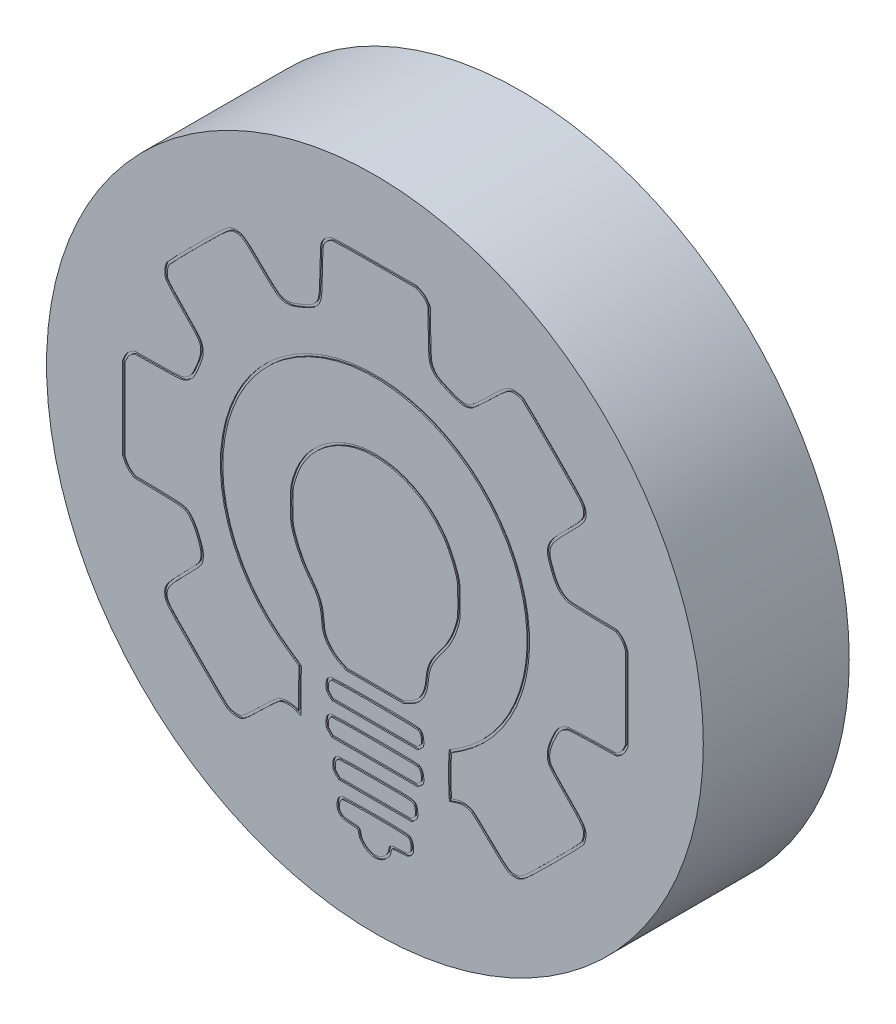
from build123d import *

# Parameters (mm, degrees)
SKETCH1_R           = 27
SKETCH1_R_2         = 25.025
BOSS_EXTRUDE1_DEPTH = 10
SKETCH2_R           = 27
BOSS_EXTRUDE3_DEPTH = 2
CUT_EXTRUDE1_DEPTH  = 0.1


with BuildPart() as part:
    # Sketch1 → Boss-Extrude1 (new body)
    with BuildSketch(Plane.XY):
        Circle(SKETCH1_R)
        Circle(SKETCH1_R_2, mode=Mode.SUBTRACT)
    extrude(amount=BOSS_EXTRUDE1_DEPTH)

    # Sketch2 → Boss-Extrude3 (add)
    with BuildSketch(Plane.XY.offset(10)):
        Circle(SKETCH2_R)
    extrude(amount=BOSS_EXTRUDE3_DEPTH)

    # Sketch4 → Cut-Extrude1 (cut)
    # profile 1 of 6: a face of its own
    with BuildSketch(Plane.XY.offset(12)):
        with BuildLine():
            Line((-17.8576224, 4.620282801), (-19.804957, 4.585005001))
            Line((-19.804957, 4.585005001), (-20.1012904, 4.387449401))
            add(Edge.make_bspline(
                [(-20.1012904, 4.387449401), (-20.3059016, 4.246338201), (-20.4540684, 4.077004601), (-20.574013, 3.823004601)],
                knots=[0, 0, 0, 0, 1, 1, 1, 1], degree=3))
            Line((-20.574013, 3.823004601), (-20.7433464, 3.456115401))
            Line((-20.7433464, 3.456115401), (-20.7433464, 0.062391001))
            Line((-20.7433464, 0.062391001), (-20.7433464, -3.324277799))
            Line((-20.7433464, -3.324277799), (-20.5669574, -3.684111399))
            add(Edge.make_bspline(
                [(-20.5669574, -3.684111399), (-20.4540684, -3.909889199), (-20.2776794, -4.121555999), (-20.0942348, -4.241500599)],
                knots=[0, 0, 0, 0, 1, 1, 1, 1], degree=3))
            Line((-20.0942348, -4.241500599), (-19.804957, -4.446111799))
            Line((-19.804957, -4.446111799), (-17.8576224, -4.481389599))
            add(Edge.make_bspline(
                [(-17.8576224, -4.481389599), (-15.6562876, -4.523722999), (-15.585732, -4.537833999), (-15.1412318, -5.052889999)],
                knots=[0, 0, 0, 0, 1, 1, 1, 1], degree=3))
            add(Edge.make_bspline(
                [(-15.1412318, -5.052889999), (-14.8590094, -5.384501199), (-14.4215646, -6.344057399), (-14.3298424, -6.859113399)],
                knots=[0, 0, 0, 0, 1, 1, 1, 1], degree=3))
            add(Edge.make_bspline(
                [(-14.3298424, -6.859113399), (-14.2945646, -7.035502399), (-14.3016202, -7.303613599), (-14.336898, -7.501169199)],
                knots=[0, 0, 0, 0, 1, 1, 1, 1], degree=3))
            add(Edge.make_bspline(
                [(-14.336898, -7.501169199), (-14.4074536, -7.804558399), (-14.513287, -7.938613999), (-15.7056766, -9.138059199)],
                knots=[0, 0, 0, 0, 1, 1, 1, 1], degree=3))
            add(Edge.make_bspline(
                [(-15.7056766, -9.138059199), (-17.0391774, -10.485671199), (-17.2790664, -10.824337999), (-17.286122, -11.318227199)],
                knots=[0, 0, 0, 0, 1, 1, 1, 1], degree=3))
            add(Edge.make_bspline(
                [(-17.286122, -11.318227199), (-17.286122, -11.960283199), (-17.2578998, -11.995560999), (-14.753176, -14.521451399)],
                knots=[0, 0, 0, 0, 1, 1, 1, 1], degree=3))
            add(Edge.make_bspline(
                [(-14.753176, -14.521451399), (-13.4478974, -15.833785599), (-12.28373, -16.969730799), (-12.1567298, -17.047341999)],
                knots=[0, 0, 0, 0, 1, 1, 1, 1], degree=3))
            add(Edge.make_bspline(
                [(-12.1567298, -17.047341999), (-11.8603964, -17.230786599), (-11.3100626, -17.294286599), (-10.9643402, -17.181397599)],
                knots=[0, 0, 0, 0, 1, 1, 1, 1], degree=3))
            add(Edge.make_bspline(
                [(-10.9643402, -17.181397599), (-10.759729, -17.117897599), (-10.357562, -16.765119599), (-9.3838948, -15.805563399)],
                knots=[0, 0, 0, 0, 1, 1, 1, 1], degree=3))
            add(Edge.make_bspline(
                [(-9.3838948, -15.805563399), (-8.6642276, -15.100007399), (-7.9657272, -14.457951399), (-7.8316716, -14.387395799)],
                knots=[0, 0, 0, 0, 1, 1, 1, 1], degree=3))
            add(Edge.make_bspline(
                [(-7.8316716, -14.387395799), (-7.4859492, -14.203951199), (-6.829782, -14.218062399), (-6.399393, -14.408562599)],
                knots=[0, 0, 0, 0, 1, 1, 1, 1], degree=3))
            Line((-6.399393, -14.408562599), (-6.0677816, -14.563784799))
            Line((-6.0677816, -14.563784799), (-6.0677816, -12.799894799))
            add(Edge.make_bspline(
                [(-6.0677816, -12.799894799), (-6.0677816, -11.833283199), (-6.060726, -11.021893799), (-6.0536704, -10.986615999)],
                knots=[0, 0, 0, 0, 1, 1, 1, 1], degree=3))
            add(Edge.make_bspline(
                [(-6.0536704, -10.986615999), (-6.0536704, -10.958393599), (-6.413504, -10.690282399), (-6.8650598, -10.386893399)],
                knots=[0, 0, 0, 0, 1, 1, 1, 1], degree=3))
            add(Edge.make_bspline(
                [(-6.8650598, -10.386893399), (-9.3133392, -8.750003399), (-10.9784514, -6.576890999), (-11.881563, -3.839333599)],
                knots=[0, 0, 0, 0, 1, 1, 1, 1], degree=3))
            add(Edge.make_bspline(
                [(-11.881563, -3.839333599), (-13.5607864, 1.219502801), (-11.7968964, 6.863950801), (-7.5423936, 10.067175201)],
                knots=[0, 0, 0, 0, 1, 1, 1, 1], degree=3))
            add(Edge.make_bspline(
                [(-7.5423936, 10.067175201), (-3.3796132, 13.192788201), (2.2366126, 13.432677201), (6.6675042, 10.666897801)],
                knots=[0, 0, 0, 0, 1, 1, 1, 1], degree=3))
            add(Edge.make_bspline(
                [(6.6675042, 10.666897801), (11.5005628, 7.654173601), (13.6807308, 1.621669801), (11.8886186, -3.811111399)],
                knots=[0, 0, 0, 0, 1, 1, 1, 1], degree=3))
            add(Edge.make_bspline(
                [(11.8886186, -3.811111399), (11.0066736, -6.506335399), (9.299228, -8.757058999), (6.942671, -10.337504399)],
                knots=[0, 0, 0, 0, 1, 1, 1, 1], degree=3))
            add(Edge.make_bspline(
                [(6.942671, -10.337504399), (6.5475596, -10.598560199), (6.1947816, -10.824337999), (6.1453928, -10.838449199)],
                knots=[0, 0, 0, 0, 1, 1, 1, 1], degree=3))
            add(Edge.make_bspline(
                [(6.1453928, -10.838449199), (6.0183926, -10.880782599), (6.0254482, -14.542618199), (6.1524484, -14.521451399)],
                knots=[0, 0, 0, 0, 1, 1, 1, 1], degree=3))
            add(Edge.make_bspline(
                [(6.1524484, -14.521451399), (6.2018372, -14.514395999), (6.4346708, -14.436784799), (6.6675042, -14.359173599)],
                knots=[0, 0, 0, 0, 1, 1, 1, 1], degree=3))
            add(Edge.make_bspline(
                [(6.6675042, -14.359173599), (7.1261156, -14.189840199), (7.5423936, -14.211006799), (7.937505, -14.408562599)],
                knots=[0, 0, 0, 0, 1, 1, 1, 1], degree=3))
            add(Edge.make_bspline(
                [(7.937505, -14.408562599), (8.050394, -14.472062599), (8.7206722, -15.085896199), (9.4191726, -15.777341199)],
                knots=[0, 0, 0, 0, 1, 1, 1, 1], degree=3))
            add(Edge.make_bspline(
                [(9.4191726, -15.777341199), (10.7032846, -17.047341999), (10.985507, -17.251953199), (11.4370628, -17.251953199)],
                knots=[0, 0, 0, 0, 1, 1, 1, 1], degree=3))
            add(Edge.make_bspline(
                [(11.4370628, -17.251953199), (12.0650076, -17.251953199), (12.1143966, -17.216675399), (14.6261758, -14.719007199)],
                knots=[0, 0, 0, 0, 1, 1, 1, 1], degree=3))
            add(Edge.make_bspline(
                [(14.6261758, -14.719007199), (15.93851, -13.413728599), (17.0744552, -12.249561199), (17.1520664, -12.122560999)],
                knots=[0, 0, 0, 0, 1, 1, 1, 1], degree=3))
            add(Edge.make_bspline(
                [(17.1520664, -12.122560999), (17.2296776, -12.002616599), (17.3072886, -11.741560799), (17.335511, -11.544005199)],
                knots=[0, 0, 0, 0, 1, 1, 1, 1], degree=3))
            add(Edge.make_bspline(
                [(17.335511, -11.544005199), (17.413122, -10.887837999), (17.2720108, -10.676171199), (15.8538434, -9.250948199)],
                knots=[0, 0, 0, 0, 1, 1, 1, 1], degree=3))
            add(Edge.make_bspline(
                [(15.8538434, -9.250948199), (15.105954, -8.503058799), (14.5415092, -7.875113999), (14.4780092, -7.734002799)],
                knots=[0, 0, 0, 0, 1, 1, 1, 1], degree=3))
            add(Edge.make_bspline(
                [(14.4780092, -7.734002799), (14.2945646, -7.296557999), (14.3439534, -6.845002199), (14.640287, -6.104168399)],
                knots=[0, 0, 0, 0, 1, 1, 1, 1], degree=3))
            add(Edge.make_bspline(
                [(14.640287, -6.104168399), (15.0353984, -5.130501199), (15.2470652, -4.855334199), (15.8044544, -4.608389599)],
                knots=[0, 0, 0, 0, 1, 1, 1, 1], degree=3))
            add(Edge.make_bspline(
                [(15.8044544, -4.608389599), (15.9102878, -4.559000799), (16.7287328, -4.509611799), (17.928178, -4.488445199)],
                knots=[0, 0, 0, 0, 1, 1, 1, 1], degree=3))
            Line((17.928178, -4.488445199), (19.8755126, -4.446111799))
            Line((19.8755126, -4.446111799), (20.157735, -4.255611599))
            add(Edge.make_bspline(
                [(20.157735, -4.255611599), (20.3411794, -4.135667199), (20.510513, -3.938111399), (20.6304574, -3.698222399)],
                knots=[0, 0, 0, 0, 1, 1, 1, 1], degree=3))
            Line((20.6304574, -3.698222399), (20.813902, -3.324277799))
            Line((20.813902, -3.324277799), (20.813902, 0.062391001))
            Line((20.813902, 0.062391001), (20.813902, 3.456115401))
            Line((20.813902, 3.456115401), (20.6445686, 3.823004601))
            add(Edge.make_bspline(
                [(20.6445686, 3.823004601), (20.524624, 4.077004601), (20.3764572, 4.246338201), (20.171846, 4.387449401)],
                knots=[0, 0, 0, 0, 1, 1, 1, 1], degree=3))
            Line((20.171846, 4.387449401), (19.8755126, 4.585005001))
            Line((19.8755126, 4.585005001), (17.928178, 4.620282801))
            add(Edge.make_bspline(
                [(17.928178, 4.620282801), (16.0937324, 4.655560601), (15.9667322, 4.669671801), (15.6845098, 4.810783001)],
                knots=[0, 0, 0, 0, 1, 1, 1, 1], degree=3))
            add(Edge.make_bspline(
                [(15.6845098, 4.810783001), (15.2611762, 5.036560801), (15.0142316, 5.382283201), (14.6826204, 6.207783801)],
                knots=[0, 0, 0, 0, 1, 1, 1, 1], degree=3))
            add(Edge.make_bspline(
                [(14.6826204, 6.207783801), (14.1393422, 7.576562401), (14.2310646, 7.830562601), (15.9102878, 9.488619201)],
                knots=[0, 0, 0, 0, 1, 1, 1, 1], degree=3))
            add(Edge.make_bspline(
                [(15.9102878, 9.488619201), (17.1167886, 10.681008801), (17.349622, 10.998509001), (17.3566776, 11.457120401)],
                knots=[0, 0, 0, 0, 1, 1, 1, 1], degree=3))
            add(Edge.make_bspline(
                [(17.3566776, 11.457120401), (17.3566776, 12.099176401), (17.3284554, 12.134454201), (14.8237316, 14.660344601)],
                knots=[0, 0, 0, 0, 1, 1, 1, 1], degree=3))
            add(Edge.make_bspline(
                [(14.8237316, 14.660344601), (13.518453, 15.972678801), (12.3542856, 17.108624001), (12.2272854, 17.186235201)],
                knots=[0, 0, 0, 0, 1, 1, 1, 1], degree=3))
            add(Edge.make_bspline(
                [(12.2272854, 17.186235201), (12.107341, 17.263846401), (11.8462852, 17.341457401), (11.6487296, 17.369679801)],
                knots=[0, 0, 0, 0, 1, 1, 1, 1], degree=3))
            add(Edge.make_bspline(
                [(11.6487296, 17.369679801), (10.9925624, 17.447290801), (10.7667846, 17.306179601), (9.348617, 15.902123201)],
                knots=[0, 0, 0, 0, 1, 1, 1, 1], degree=3))
            add(Edge.make_bspline(
                [(9.348617, 15.902123201), (8.5725054, 15.140122801), (7.9727828, 14.603900201), (7.810505, 14.533344601)],
                knots=[0, 0, 0, 0, 1, 1, 1, 1], degree=3))
            add(Edge.make_bspline(
                [(7.810505, 14.533344601), (7.3801158, 14.356955601), (7.0202822, 14.399289001), (6.1806706, 14.745011401)],
                knots=[0, 0, 0, 0, 1, 1, 1, 1], degree=3))
            add(Edge.make_bspline(
                [(6.1806706, 14.745011401), (5.2563922, 15.126011601), (5.002392, 15.302400601), (4.7907252, 15.746901001)],
                knots=[0, 0, 0, 0, 1, 1, 1, 1], degree=3))
            add(Edge.make_bspline(
                [(4.7907252, 15.746901001), (4.6284474, 16.071456601), (4.6213918, 16.170234601), (4.586114, 17.997624601)],
                knots=[0, 0, 0, 0, 1, 1, 1, 1], degree=3))
            Line((4.586114, 17.997624601), (4.5508362, 19.909681401))
            Line((4.5508362, 19.909681401), (4.360336, 20.191903801))
            add(Edge.make_bspline(
                [(4.360336, 20.191903801), (4.2403916, 20.375348201), (4.0428358, 20.544681801), (3.8029468, 20.664626201)],
                knots=[0, 0, 0, 0, 1, 1, 1, 1], degree=3))
            Line((3.8029468, 20.664626201), (3.4290022, 20.848070801))
            Line((3.4290022, 20.848070801), (0.0423334, 20.841015201))
            add(Edge.make_bspline(
                [(0.0423334, 20.841015201), (-2.166057, 20.841015201), (-3.4290022, 20.812793001), (-3.5630578, 20.763404001)],
                knots=[0, 0, 0, 0, 1, 1, 1, 1], degree=3))
            add(Edge.make_bspline(
                [(-3.5630578, 20.763404001), (-3.8876136, 20.643459601), (-4.1345582, 20.445903801), (-4.3180028, 20.156626001)],
                knots=[0, 0, 0, 0, 1, 1, 1, 1], degree=3))
            add(Edge.make_bspline(
                [(-4.3180028, 20.156626001), (-4.473225, 19.902625801), (-4.4802806, 19.825014601), (-4.5155584, 17.990569001)],
                knots=[0, 0, 0, 0, 1, 1, 1, 1], degree=3))
            add(Edge.make_bspline(
                [(-4.5155584, 17.990569001), (-4.5578918, 15.888012201), (-4.5790584, 15.782178801), (-5.0235588, 15.337678401)],
                knots=[0, 0, 0, 0, 1, 1, 1, 1], degree=3))
            add(Edge.make_bspline(
                [(-5.0235588, 15.337678401), (-5.3128366, 15.041345001), (-6.575782, 14.498066801), (-7.0767266, 14.441622401)],
                knots=[0, 0, 0, 0, 1, 1, 1, 1], degree=3))
            add(Edge.make_bspline(
                [(-7.0767266, 14.441622401), (-7.697616, 14.378122201), (-7.9163384, 14.526289001), (-9.285117, 15.888012201)],
                knots=[0, 0, 0, 0, 1, 1, 1, 1], degree=3))
            add(Edge.make_bspline(
                [(-9.285117, 15.888012201), (-10.5621734, 17.158013001), (-10.8796736, 17.383790801), (-11.3594516, 17.390846401)],
                knots=[0, 0, 0, 0, 1, 1, 1, 1], degree=3))
            add(Edge.make_bspline(
                [(-11.3594516, 17.390846401), (-12.0085632, 17.390846401), (-12.0297298, 17.376735201), (-14.5556202, 14.864956001)],
                knots=[0, 0, 0, 0, 1, 1, 1, 1], degree=3))
            add(Edge.make_bspline(
                [(-14.5556202, 14.864956001), (-15.8679544, 13.552621801), (-17.0038996, 12.388454401), (-17.0815108, 12.261454201)],
                knots=[0, 0, 0, 0, 1, 1, 1, 1], degree=3))
            add(Edge.make_bspline(
                [(-17.0815108, 12.261454201), (-17.2649554, 11.965120801), (-17.3284554, 11.414787001), (-17.2155664, 11.069064601)],
                knots=[0, 0, 0, 0, 1, 1, 1, 1], degree=3))
            add(Edge.make_bspline(
                [(-17.2155664, 11.069064601), (-17.1450108, 10.864453401), (-16.7851772, 10.448175401), (-15.7973988, 9.446285801)],
                knots=[0, 0, 0, 0, 1, 1, 1, 1], degree=3))
            add(Edge.make_bspline(
                [(-15.7973988, 9.446285801), (-14.3933424, 8.021062801), (-14.3227868, 7.915229401), (-14.3227868, 7.252006601)],
                knots=[0, 0, 0, 0, 1, 1, 1, 1], degree=3))
            add(Edge.make_bspline(
                [(-14.3227868, 7.252006601), (-14.3227868, 6.871006401), (-14.8378426, 5.565727801), (-15.1130096, 5.220005401)],
                knots=[0, 0, 0, 0, 1, 1, 1, 1], degree=3))
            add(Edge.make_bspline(
                [(-15.1130096, 5.220005401), (-15.232954, 5.085949801), (-15.458732, 4.895449601), (-15.6139542, 4.810783001)],
                knots=[0, 0, 0, 0, 1, 1, 1, 1], degree=3))
            add(Edge.make_bspline(
                [(-15.6139542, 4.810783001), (-15.8961766, 4.669671801), (-16.0231768, 4.655560601), (-17.8576224, 4.620282801)],
                knots=[0, 0, 0, 0, 1, 1, 1, 1], degree=3))
        make_face()
        with BuildLine():
            Line((-17.853999804, 4.420315488), (-19.742760988, 4.386098924))
            Line((-19.742760988, 4.386098924), (-19.988998471, 4.221940602))
            add(Edge.make_bspline(
                [(-19.988998471, 4.221940602), (-20.031944805, 4.192256832), (-20.116259085, 4.126719412), (-20.219217971, 4.020611115), (-20.309944432, 3.897840015), (-20.368230777, 3.790401494), (-20.393163313, 3.73760325)],
                knots=[0.002322855, 0.002322855, 0.002322855, 0.002322855, 0.251742141, 0.501161428, 0.750580714, 1, 1, 1, 1], degree=3))
            Line((-20.393163313, 3.73760325), (-20.5433464, 3.412188051))
            Line((-20.5433464, 3.412188051), (-20.5433464, 0.062391001))
            Line((-20.5433464, 0.062391001), (-20.5433464, -3.277894705))
            Line((-20.5433464, -3.277894705), (-20.388071993, -3.594668616))
            add(Edge.make_bspline(
                [(-20.388071993, -3.594668616), (-20.36300028, -3.644811999), (-20.306692463, -3.741726783), (-20.204944513, -3.87808915), (-20.091758875, -3.995251995), (-20.02105145, -4.050393939), (-19.981725799, -4.076106876)],
                knots=[0, 0, 0, 0, 0.251389654, 0.502779308, 0.754168962, 1.005558616, 1.005558616, 1.005558616, 1.005558616], degree=3))
            Line((-19.981725799, -4.076106876), (-19.73975041, -4.247260262))
            Line((-19.73975041, -4.247260262), (-17.853999882, -4.281422284))
            add(Edge.make_bspline(
                [(-17.853999882, -4.281422284), (-17.724361492, -4.283915332), (-17.453819989, -4.28921633), (-17.002896567, -4.299435132), (-16.534034814, -4.314630288), (-16.110990122, -4.343193124), (-15.680895353, -4.404039237), (-15.304018058, -4.560937294), (-15.092512889, -4.803227299), (-14.989370443, -4.922741611)],
                knots=[-3.3757e-05, -3.3757e-05, -3.3757e-05, -3.3757e-05, 0.062489449, 0.125012655, 0.250059066, 0.375105477, 0.500151889, 0.750244711, 1.000337534, 1.000337534, 1.000337534, 1.000337534], degree=3))
            add(Edge.make_bspline(
                [(-14.989370443, -4.922741611), (-14.943565969, -4.976561849), (-14.865228651, -5.084425358), (-14.691415251, -5.369134945), (-14.477300316, -5.794339099), (-14.25237379, -6.357143527), (-14.162826339, -6.657345704), (-14.133303292, -6.822016799)],
                knots=[-0.000527359, -0.000527359, -0.000527359, -0.000527359, 0.124392901, 0.249313161, 0.499153681, 0.748994201, 0.998834721, 0.998834721, 0.998834721, 0.998834721], degree=3))
            add(Edge.make_bspline(
                [(-14.133303292, -6.822016799), (-14.122010333, -6.87911225), (-14.108769219, -6.992419568), (-14.104515176, -7.179293924), (-14.115219055, -7.368648653), (-14.130535539, -7.483256449), (-14.140923069, -7.541426597)],
                knots=[0.003225677, 0.003225677, 0.003225677, 0.003225677, 0.254570237, 0.505914798, 0.757259358, 1.008603918, 1.008603918, 1.008603918, 1.008603918], degree=3))
            add(Edge.make_bspline(
                [(-14.140923069, -7.541426597), (-14.161930305, -7.631757747), (-14.212209282, -7.797171483), (-14.379265265, -8.037861162), (-14.605823018, -8.295371401), (-14.838349455, -8.542364551), (-15.097406128, -8.807985278), (-15.345366016, -9.05907912), (-15.492798022, -9.207601592), (-15.563675457, -9.278898571)],
                knots=[-0.005543247, -0.005543247, -0.005543247, -0.005543247, 0.245831167, 0.497205581, 0.622892788, 0.748579995, 0.874267202, 0.937110805, 0.999954408, 0.999954408, 0.999954408, 0.999954408], degree=3))
            add(Edge.make_bspline(
                [(-15.563675457, -9.278898571), (-15.642675197, -9.358734757), (-15.806006643, -9.524544971), (-16.085236301, -9.811778374), (-16.380711098, -10.124429668), (-16.648528199, -10.427212796), (-16.906197943, -10.755083667), (-17.059930803, -11.036057514), (-17.084600877, -11.220338725), (-17.086121949, -11.319701537)],
                knots=[4.0741e-05, 4.0741e-05, 4.0741e-05, 4.0741e-05, 0.062471231, 0.124901721, 0.249762701, 0.374623681, 0.499484661, 0.74920662, 0.99892858, 0.99892858, 0.99892858, 0.99892858], degree=3))
            add(Edge.make_bspline(
                [(-17.086121949, -11.319701537), (-17.086117231, -11.386745649), (-17.084413907, -11.535532863), (-17.059236366, -11.670071993), (-16.987890391, -11.835250623), (-16.822265487, -12.073416255), (-16.531181, -12.412380745), (-16.091097528, -12.879671258), (-15.572807314, -13.40925747), (-15.065405262, -13.922489815), (-14.75822922, -14.232315132), (-14.611267357, -14.380518933)],
                knots=[0.000773296, 0.000773296, 0.000773296, 0.000773296, 0.125674862, 0.250576429, 0.375477995, 0.500379561, 0.625281128, 0.750182694, 0.87508426, 0.937535043, 0.999985827, 0.999985827, 0.999985827, 0.999985827], degree=3))
            add(Edge.make_bspline(
                [(-14.611267357, -14.380518933), (-14.306717222, -14.686714855), (-13.666692614, -15.326098179), (-13.006589843, -15.975708319), (-12.575900628, -16.393082636), (-12.314904262, -16.641501084), (-12.160719843, -16.784223679), (-12.073986415, -16.859392789), (-12.061051316, -16.870198486), (-12.050135025, -16.878106022)],
                knots=[2.7251e-05, 2.7251e-05, 2.7251e-05, 2.7251e-05, 0.244110931, 0.488194611, 0.610236451, 0.732278291, 0.854320131, 0.915341051, 0.976361971, 0.976361971, 0.976361971, 0.976361971], degree=3))
            add(Edge.make_bspline(
                [(-12.050135025, -16.878106022), (-11.983367151, -16.919189423), (-11.849376241, -16.974046867), (-11.555974492, -17.036665757), (-11.254124432, -17.041223723), (-11.102796832, -17.016215711), (-11.025023577, -16.990820351)],
                knots=[0.002002929, 0.002002929, 0.002002929, 0.002002929, 0.251838933, 0.501674936, 0.75151094, 1.001346943, 1.001346943, 1.001346943, 1.001346943], degree=3))
            add(Edge.make_bspline(
                [(-11.025023577, -16.990820351), (-11.007260856, -16.985307785), (-10.98408744, -16.975239279), (-10.857298262, -16.898555205), (-10.622517653, -16.710432005), (-10.252930555, -16.370925917), (-9.875387641, -16.007760256), (-9.636674156, -15.773878692), (-9.524094851, -15.662930957)],
                knots=[-0.002286545, -0.002286545, -0.002286545, -0.002286545, 0.123007203, 0.248300951, 0.498888447, 0.749475942, 0.87476969, 1.000063438, 1.000063438, 1.000063438, 1.000063438], degree=3))
            add(Edge.make_bspline(
                [(-9.524094851, -15.662930957), (-9.34891405, -15.491185093), (-8.982549844, -15.137313644), (-8.506149411, -14.692285877), (-8.196374542, -14.415856912), (-8.023290845, -14.275051966), (-7.962393965, -14.230241667), (-7.92516459, -14.2105933)],
                knots=[-8.6047e-05, -8.6047e-05, -8.6047e-05, -8.6047e-05, 0.249846695, 0.499779438, 0.749712181, 0.874678553, 0.999644924, 0.999644924, 0.999644924, 0.999644924], degree=3))
            add(Edge.make_bspline(
                [(-7.92516459, -14.2105933), (-7.811299785, -14.150220221), (-7.56742397, -14.076567725), (-7.144579367, -14.044726801), (-6.709059692, -14.091343912), (-6.443745675, -14.170215239), (-6.316515073, -14.226530468)],
                knots=[0.000188654, 0.000188654, 0.000188654, 0.000188654, 0.250514884, 0.500841113, 0.751167343, 1.001493572, 1.001493572, 1.001493572, 1.001493572], degree=3))
            Line((-6.316515073, -14.226530468), (-6.2677816, -14.249341858))
            Line((-6.2677816, -14.249341858), (-6.2677816, -12.799894799))
            add(Edge.make_bspline(
                [(-6.2677816, -12.799894799), (-6.2677816, -12.608473499), (-6.267182992, -12.209786333), (-6.264825426, -11.706826682), (-6.262045632, -11.372930591), (-6.259310913, -11.168973206), (-6.258138498, -11.104254677), (-6.257253653, -11.067243772)],
                knots=[0, 0, 0, 0, 0.206566596, 0.413133192, 0.619699788, 0.722983086, 0.826266384, 0.826266384, 0.826266384, 0.826266384], degree=3))
            add(Edge.make_bspline(
                [(-6.257253653, -11.067243772), (-6.295588272, -11.036072054), (-6.362075568, -10.984982701), (-6.535968972, -10.857292412), (-6.738361702, -10.714718854), (-6.898814391, -10.605165246), (-6.976410537, -10.553029081)],
                knots=[0.277509677, 0.277509677, 0.277509677, 0.277509677, 0.458097373, 0.638685068, 0.819272763, 0.999860458, 0.999860458, 0.999860458, 0.999860458], degree=3))
            add(Edge.make_bspline(
                [(-6.976410537, -10.553029081), (-7.580755516, -10.148958006), (-8.746945247, -9.235362339), (-10.159181577, -7.682029322), (-11.285444171, -5.921439665), (-11.847313247, -4.581511199), (-12.071436928, -3.902166112)],
                knots=[2.5476e-05, 2.5476e-05, 2.5476e-05, 2.5476e-05, 0.250013865, 0.500002254, 0.749990643, 0.999979032, 0.999979032, 0.999979032, 0.999979032], degree=3))
            add(Edge.make_bspline(
                [(-12.071436928, -3.902166112), (-12.282228025, -3.267104681), (-12.603137776, -1.952310757), (-12.813485192, 0.676099754), (-12.317130169, 3.928676141), (-10.875097095, 6.885456928), (-9.207685602, 8.926693482), (-8.196759389, 9.824850469), (-7.662585295, 10.227031304)],
                knots=[1.133e-05, 1.133e-05, 1.133e-05, 1.133e-05, 0.125010941, 0.250010551, 0.500009773, 0.750008995, 0.875008605, 1.000008216, 1.000008216, 1.000008216, 1.000008216], degree=3))
            add(Edge.make_bspline(
                [(-7.662585295, 10.227031304), (-7.140907212, 10.618731956), (-6.027732184, 11.328372908), (-3.682853066, 12.360842936), (-0.555089935, 12.964067685), (2.615418046, 12.627582193), (5.044778987, 11.796710786), (6.218325729, 11.183038292), (6.773355171, 10.836590393)],
                knots=[-8.405e-06, -8.405e-06, -8.405e-06, -8.405e-06, 0.124992167, 0.249992739, 0.499993884, 0.749995028, 0.874995601, 0.999996173, 0.999996173, 0.999996173, 0.999996173], degree=3))
            add(Edge.make_bspline(
                [(6.773355171, 10.836590393), (7.379074432, 10.459006529), (8.534841449, 9.590135935), (10.458198228, 7.544909813), (12.161926063, 4.480563269), (12.809013675, 1.030300858), (12.636804497, -1.779923836), (12.303087842, -3.193040738), (12.078626469, -3.873537882)],
                knots=[3.509e-06, 3.509e-06, 3.509e-06, 3.509e-06, 0.125001358, 0.249999208, 0.499994908, 0.749990608, 0.874988458, 0.999986308, 0.999986308, 0.999986308, 0.999986308], degree=3))
            add(Edge.make_bspline(
                [(12.078626469, -3.873537882), (11.857632096, -4.548855618), (11.300914548, -5.874102573), (10.173959006, -7.64849283), (8.769640765, -9.213114928), (7.643893104, -10.108037585), (7.053497388, -10.503991595)],
                knots=[2.7633e-05, 2.7633e-05, 2.7633e-05, 2.7633e-05, 0.250040962, 0.500054291, 0.75006762, 1.00008095, 1.00008095, 1.00008095, 1.00008095], degree=3))
            add(Edge.make_bspline(
                [(7.053497388, -10.503991595), (6.976767671, -10.554688025), (6.817738761, -10.659153263), (6.610119452, -10.793632721), (6.4284188, -10.908248641), (6.35357326, -10.953864522), (6.309526847, -10.979095707)],
                knots=[-0.000485027, -0.000485027, -0.000485027, -0.000485027, 0.199236321, 0.39895767, 0.598679018, 0.798400367, 0.798400367, 0.798400367, 0.798400367], degree=3))
            add(Edge.make_bspline(
                [(6.309526847, -10.979095707), (6.304484903, -11.013501136), (6.297864558, -11.073245619), (6.282332961, -11.268592478), (6.268020454, -11.580067285), (6.256916456, -12.039553824), (6.252594353, -12.543490524), (6.254802417, -13.056938713), (6.263607468, -13.544737706), (6.276046367, -13.896683964), (6.289574452, -14.133822393), (6.296315324, -14.221911391), (6.300776244, -14.269672652)],
                knots=[0.098871727, 0.098871727, 0.098871727, 0.098871727, 0.145400216, 0.191928704, 0.284985681, 0.378042658, 0.471099635, 0.564156612, 0.657213589, 0.750270566, 0.796799054, 0.843327543, 0.843327543, 0.843327543, 0.843327543], degree=3))
            add(Edge.make_bspline(
                [(6.300776244, -14.269672652), (6.323730382, -14.262260648), (6.368168038, -14.247775583), (6.443317561, -14.222994561), (6.521147302, -14.197139202), (6.574720233, -14.179283066), (6.601293531, -14.170425311)],
                knots=[0.53687387, 0.53687387, 0.53687387, 0.53687387, 0.651594126, 0.766314383, 0.88103464, 0.995754896, 0.995754896, 0.995754896, 0.995754896], degree=3))
            add(Edge.make_bspline(
                [(6.601293531, -14.170425311), (6.721997746, -14.126045506), (6.977004884, -14.056174175), (7.340192232, -14.033813385), (7.694989339, -14.088393432), (7.923206699, -14.177806624), (8.031308166, -14.231857385)],
                knots=[0.002040543, 0.002040543, 0.002040543, 0.002040543, 0.252450065, 0.502859588, 0.753269111, 1.003678634, 1.003678634, 1.003678634, 1.003678634], degree=3))
            add(Edge.make_bspline(
                [(8.031308166, -14.231857385), (8.062839218, -14.249593584), (8.113272978, -14.286481603), (8.272030692, -14.417854545), (8.565831182, -14.681509669), (9.027797979, -15.114864482), (9.388327402, -15.46539006), (9.559842329, -15.635172182)],
                knots=[-0.012546272, -0.012546272, -0.012546272, -0.012546272, 0.114020115, 0.240586502, 0.493719276, 0.74685205, 0.999984824, 0.999984824, 0.999984824, 0.999984824], degree=3))
            add(Edge.make_bspline(
                [(9.559842329, -15.635172182), (9.635905201, -15.71039912), (9.794000102, -15.866174495), (10.066204006, -16.131336057), (10.360390933, -16.410689756), (10.64165543, -16.661597525), (10.942078751, -16.899841769), (11.186939305, -17.033981479), (11.349902793, -17.051953199), (11.4370628, -17.051953199)],
                knots=[8.288e-06, 8.288e-06, 8.288e-06, 8.288e-06, 0.06250777, 0.125007252, 0.250006216, 0.37500518, 0.500004144, 0.750002072, 1, 1, 1, 1], degree=3))
            add(Edge.make_bspline(
                [(11.4370628, -17.051953199), (11.50267455, -17.051953199), (11.648075245, -17.0500928), (11.780631092, -17.024725746), (11.945732601, -16.952674332), (12.184143919, -16.786246275), (12.523141911, -16.49474989), (12.989854211, -16.054724067), (13.517967595, -15.53701988), (14.029247945, -15.030423973), (14.33762518, -14.723887424), (14.485144757, -14.577196604)],
                knots=[0, 0, 0, 0, 0.124999857, 0.249999714, 0.374999571, 0.499999428, 0.624999286, 0.749999143, 0.874999, 0.937498928, 0.999998857, 0.999998857, 0.999998857, 0.999998857], degree=3))
            add(Edge.make_bspline(
                [(14.485144757, -14.577196604), (14.791167198, -14.272819419), (15.430159352, -13.633189568), (16.079519094, -12.973353485), (16.496870279, -12.542704286), (16.745379643, -12.281635793), (16.888305671, -12.127252362), (16.963692831, -12.040329204), (16.97473847, -12.027104489), (16.982754811, -12.016070451)],
                knots=[2.189e-06, 2.189e-06, 2.189e-06, 2.189e-06, 0.243935921, 0.487869654, 0.60983652, 0.731803386, 0.853770253, 0.914753686, 0.975737119, 0.975737119, 0.975737119, 0.975737119], degree=3))
            add(Edge.make_bspline(
                [(16.982754811, -12.016070451), (16.999307734, -11.990488851), (17.020818945, -11.946558294), (17.07224806, -11.808276837), (17.112550125, -11.656352818), (17.130338666, -11.565371006), (17.137184993, -11.51805853)],
                knots=[-0.006009844, -0.006009844, -0.006009844, -0.006009844, 0.244357075, 0.494723995, 0.745090914, 0.995457833, 0.995457833, 0.995457833, 0.995457833], degree=3))
            add(Edge.make_bspline(
                [(17.137184993, -11.51805853), (17.145244198, -11.449533103), (17.157561732, -11.300371094), (17.140308128, -11.092037191), (17.057787791, -10.881234729), (16.824929897, -10.565461507), (16.563250345, -10.266259666), (16.261070727, -9.948696001), (15.969450025, -9.651222964), (15.795822695, -9.47618635), (15.712246277, -9.392193787)],
                knots=[0.001314798, 0.001314798, 0.001314798, 0.001314798, 0.126145306, 0.250975815, 0.500636831, 0.62546734, 0.750297848, 0.875128356, 0.93754361, 0.999958864, 0.999958864, 0.999958864, 0.999958864], degree=3))
            add(Edge.make_bspline(
                [(15.712246277, -9.392193787), (15.534601583, -9.214546742), (15.162997536, -8.834409106), (14.737624978, -8.379479592), (14.427424785, -8.014815704), (14.333324236, -7.899852092), (14.294567138, -7.813725153)],
                knots=[7.7923e-05, 7.7923e-05, 7.7923e-05, 7.7923e-05, 0.251446555, 0.502815186, 0.754183817, 1.005552449, 1.005552449, 1.005552449, 1.005552449], degree=3))
            add(Edge.make_bspline(
                [(14.294567138, -7.813725153), (14.243109575, -7.69101866), (14.168668129, -7.43472024), (14.164739087, -7.018466239), (14.25307708, -6.575468546), (14.385762932, -6.201962042), (14.454776899, -6.029427171)],
                knots=[-0.001811289, -0.001811289, -0.001811289, -0.001811289, 0.248693623, 0.499198534, 0.749703446, 1.000208358, 1.000208358, 1.000208358, 1.000208358], degree=3))
            add(Edge.make_bspline(
                [(14.454776899, -6.029427171), (14.500910205, -5.915741544), (14.600931345, -5.67700176), (14.775036469, -5.305398982), (14.99483908, -4.93950492), (15.308080995, -4.633552426), (15.583487019, -4.487600122), (15.722213463, -4.426076321)],
                knots=[-0.000158215, -0.000158215, -0.000158215, -0.000158215, 0.124774888, 0.24970799, 0.499574195, 0.7494404, 0.999306605, 0.999306605, 0.999306605, 0.999306605], degree=3))
            add(Edge.make_bspline(
                [(15.722213463, -4.426076321), (15.805856454, -4.388008894), (15.952503552, -4.376745361), (16.41364973, -4.335814232), (16.962544812, -4.312924091), (17.482685328, -4.297339838), (17.779864616, -4.291033251), (17.923831167, -4.288490774)],
                knots=[0.001884785, 0.001884785, 0.001884785, 0.001884785, 0.251356938, 0.50082909, 0.750301242, 0.875037318, 0.999773395, 0.999773395, 0.999773395, 0.999773395], degree=3))
            Line((17.923831167, -4.288490774), (19.812365803, -4.247437303))
            Line((19.812365803, -4.247437303), (20.047056808, -4.089020808))
            add(Edge.make_bspline(
                [(20.047056808, -4.089020808), (20.086061054, -4.063518035), (20.157238769, -4.008518125), (20.266766721, -3.896260395), (20.366246818, -3.763662446), (20.4255524, -3.660818846), (20.451571932, -3.608779739)],
                knots=[-0.002231974, -0.002231974, -0.002231974, -0.002231974, 0.248326019, 0.498884013, 0.749442006, 1, 1, 1, 1], degree=3))
            Line((20.451571932, -3.608779739), (20.613902, -3.277863253))
            Line((20.613902, -3.277863253), (20.613902, 0.062391001))
            Line((20.613902, 0.062391001), (20.613902, 3.412188051))
            Line((20.613902, 3.412188051), (20.463718913, 3.73760325))
            add(Edge.make_bspline(
                [(20.463718913, 3.73760325), (20.438786377, 3.790401494), (20.380500032, 3.897840015), (20.289773571, 4.020611115), (20.186814685, 4.126719412), (20.102500405, 4.192256832), (20.059554071, 4.221940602)],
                knots=[0, 0, 0, 0, 0.249419286, 0.498838572, 0.748257859, 0.997677145, 0.997677145, 0.997677145, 0.997677145], degree=3))
            Line((20.059554071, 4.221940602), (19.813316588, 4.386098924))
            Line((19.813316588, 4.386098924), (17.924332557, 4.420319773))
            add(Edge.make_bspline(
                [(17.924332557, 4.420319773), (17.815836006, 4.422406245), (17.589677432, 4.426846952), (17.210709808, 4.434908175), (16.815184303, 4.444993319), (16.458846479, 4.458662354), (16.105637991, 4.481389285), (15.822287317, 4.526325909), (15.672554322, 4.593153943), (15.592713752, 4.633074227)],
                knots=[0, 0, 0, 0, 0.06267372, 0.12534744, 0.25069488, 0.37604232, 0.50138976, 0.75208464, 1.00277952, 1.00277952, 1.00277952, 1.00277952], degree=3))
            add(Edge.make_bspline(
                [(15.592713752, 4.633074227), (15.476242309, 4.695192297), (15.256568375, 4.842005172), (14.982042054, 5.148957543), (14.780365968, 5.493416667), (14.62239964, 5.829677081), (14.536598624, 6.034743193), (14.496880264, 6.133616601)],
                knots=[-0.001827999, -0.001827999, -0.001827999, -0.001827999, 0.248667796, 0.499163591, 0.749659387, 0.874907284, 1.000155182, 1.000155182, 1.000155182, 1.000155182], degree=3))
            add(Edge.make_bspline(
                [(14.496880264, 6.133616601), (14.434271542, 6.29135803), (14.306640708, 6.628041771), (14.198554739, 7.032242995), (14.171308473, 7.426867841), (14.256843525, 7.810581593), (14.454832986, 8.187850001), (14.76071539, 8.587445674), (15.117422574, 8.974706572), (15.463609228, 9.32735762), (15.670088008, 9.532512751), (15.769733447, 9.630902285)],
                knots=[-9.3744e-05, -9.3744e-05, -9.3744e-05, -9.3744e-05, 0.124917163, 0.24992807, 0.374938976, 0.499949883, 0.62496079, 0.749971697, 0.874982604, 0.937488057, 0.99999351, 0.99999351, 0.99999351, 0.99999351], degree=3))
            add(Edge.make_bspline(
                [(15.769733447, 9.630902285), (15.905801214, 9.765378785), (16.196157466, 10.055051169), (16.508529571, 10.379165548), (16.755342539, 10.652512117), (16.990194229, 10.946443844), (17.131875332, 11.201067917), (17.155175118, 11.368429236), (17.15667754, 11.458715281)],
                knots=[9.054e-06, 9.054e-06, 9.054e-06, 9.054e-06, 0.12485043, 0.249691806, 0.374533181, 0.499374557, 0.749057309, 0.99874006, 0.99874006, 0.99874006, 0.99874006], degree=3))
            add(Edge.make_bspline(
                [(17.15667754, 11.458715281), (17.156672423, 11.525744289), (17.154963431, 11.674494252), (17.129775564, 11.809018619), (17.05840864, 11.974207727), (16.892761593, 12.212383574), (16.601664739, 12.551352312), (16.161582763, 13.018636959), (15.643310149, 13.548204163), (15.135933056, 14.061411065), (14.828776095, 14.371217134), (14.681822957, 14.519412135)],
                knots=[0.000836593, 0.000836593, 0.000836593, 0.000836593, 0.125730247, 0.250623901, 0.375517556, 0.50041121, 0.625304864, 0.750198518, 0.875092172, 0.937538999, 0.999985827, 0.999985827, 0.999985827, 0.999985827], degree=3))
            add(Edge.make_bspline(
                [(14.681822957, 14.519412135), (14.377456188, 14.825423701), (13.737847178, 15.464394299), (13.078037916, 16.11372693), (12.647406612, 16.531060268), (12.386349226, 16.779558709), (12.231972295, 16.922478462), (12.145052693, 16.997862384), (12.131828453, 17.008907589), (12.120794852, 17.016923612)],
                knots=[2.7251e-05, 2.7251e-05, 2.7251e-05, 2.7251e-05, 0.243954718, 0.487882185, 0.609845919, 0.731809652, 0.853773386, 0.914755252, 0.975737119, 0.975737119, 0.975737119, 0.975737119], degree=3))
            add(Edge.make_bspline(
                [(12.120794852, 17.016923612), (12.095213272, 17.033476522), (12.051282752, 17.05498772), (11.913001413, 17.106416803), (11.761077506, 17.146718858), (11.670095708, 17.164507412), (11.622783248, 17.171353749)],
                knots=[-0.006009844, -0.006009844, -0.006009844, -0.006009844, 0.244356922, 0.494723688, 0.745090454, 0.995457221, 0.995457221, 0.995457221, 0.995457221], degree=3))
            add(Edge.make_bspline(
                [(11.622783248, 17.171353749), (11.554028485, 17.179439453), (11.404789049, 17.19173647), (11.193216029, 17.174628074), (10.978753089, 17.092104488), (10.660912152, 16.861400686), (10.360841436, 16.602271845), (10.043487377, 16.303084026), (9.746868496, 16.014333505), (9.572635635, 15.842473738), (9.489032859, 15.759702835)],
                knots=[0.001315285, 0.001315285, 0.001315285, 0.001315285, 0.126159589, 0.251003894, 0.500692503, 0.625536807, 0.750381112, 0.875225416, 0.937647569, 1.000069721, 1.000069721, 1.000069721, 1.000069721], degree=3))
            add(Edge.make_bspline(
                [(9.489032859, 15.759702835), (9.307356535, 15.581329735), (8.917023575, 15.205156865), (8.464363541, 14.787307992), (8.101290493, 14.483596599), (7.977318838, 14.387786529), (7.888308684, 14.349086442)],
                knots=[-0.000127924, -0.000127924, -0.000127924, -0.000127924, 0.250901098, 0.50193012, 0.752959142, 1.003988164, 1.003988164, 1.003988164, 1.003988164], degree=3))
            add(Edge.make_bspline(
                [(7.888308684, 14.349086442), (7.771062782, 14.301034848), (7.526894235, 14.227308747), (7.134367902, 14.226879384), (6.760321602, 14.316304076), (6.41390043, 14.436039032), (6.203941691, 14.519137704), (6.10448515, 14.560090395)],
                knots=[-0.001517236, -0.001517236, -0.001517236, -0.001517236, 0.248865596, 0.499248427, 0.749631259, 0.874822675, 1.000014091, 1.000014091, 1.000014091, 1.000014091], degree=3))
            add(Edge.make_bspline(
                [(6.10448515, 14.560090395), (5.997235272, 14.604300261), (5.771237136, 14.699699563), (5.422148465, 14.860776485), (5.082411826, 15.053333668), (4.797091019, 15.318267325), (4.666303117, 15.543227636), (4.610989383, 15.659159795)],
                knots=[-1.2798e-05, -1.2798e-05, -1.2798e-05, -1.2798e-05, 0.124837068, 0.249686934, 0.499386666, 0.749086398, 0.99878613, 0.99878613, 0.99878613, 0.99878613], degree=3))
            add(Edge.make_bspline(
                [(4.610989383, 15.659159795), (4.568266602, 15.744681852), (4.493420846, 15.908335121), (4.445897282, 16.194720845), (4.423076355, 16.544863521), (4.409910479, 16.896582927), (4.400354543, 17.287291136), (4.392591317, 17.662231128), (4.388223406, 17.886427044), (4.386147959, 17.993935191)],
                knots=[0.001683746, 0.001683746, 0.001683746, 0.001683746, 0.251270602, 0.500857457, 0.625650885, 0.750444313, 0.875237741, 0.937634455, 1.000031169, 1.000031169, 1.000031169, 1.000031169], degree=3))
            Line((4.386147959, 17.993935191), (4.351961767, 19.846830807))
            Line((4.351961767, 19.846830807), (4.193745209, 20.081225609))
            add(Edge.make_bspline(
                [(4.193745209, 20.081225609), (4.168242436, 20.120229855), (4.113242526, 20.19140757), (4.000984797, 20.300935522), (3.868386847, 20.40041562), (3.765543247, 20.459721201), (3.713504141, 20.485740733)],
                knots=[-0.002231974, -0.002231974, -0.002231974, -0.002231974, 0.248326019, 0.498884013, 0.749442006, 1, 1, 1, 1], degree=3))
            Line((3.713504141, 20.485740733), (3.382784816, 20.64797408))
            Line((3.382784816, 20.64797408), (0.0423334, 20.641015201))
            add(Edge.make_bspline(
                [(0.0423334, 20.641015201), (-0.208070789, 20.641015201), (-0.728925505, 20.640209631), (-1.610256584, 20.63544926), (-2.515251693, 20.623925292), (-3.118537116, 20.604927048), (-3.371538896, 20.589236774), (-3.469964967, 20.578718089), (-3.486917863, 20.576302824), (-3.499249916, 20.573752733)],
                knots=[0, 0, 0, 0, 0.119667121, 0.239334242, 0.478668484, 0.718002726, 0.837669847, 0.897503407, 0.957336968, 0.957336968, 0.957336968, 0.957336968], degree=3))
            add(Edge.make_bspline(
                [(-3.499249916, 20.573752733), (-3.567602425, 20.548204926), (-3.703913988, 20.485688254), (-3.873309557, 20.370590827), (-4.021165295, 20.23014612), (-4.109565844, 20.111714739), (-4.14822685, 20.050894553)],
                knots=[0.006391819, 0.006391819, 0.006391819, 0.006391819, 0.254344445, 0.502297071, 0.750249697, 0.998202323, 0.998202323, 0.998202323, 0.998202323], degree=3))
            add(Edge.make_bspline(
                [(-4.14822685, 20.050894553), (-4.176124893, 20.005194273), (-4.224967596, 19.922145738), (-4.25764498, 19.741818165), (-4.279442613, 19.419781667), (-4.291967906, 19.080437983), (-4.301436744, 18.693364565), (-4.309158432, 18.319162447), (-4.313525961, 18.094332922), (-4.315597108, 17.986633262)],
                knots=[0.002001174, 0.002001174, 0.002001174, 0.002001174, 0.251504982, 0.501008791, 0.625760695, 0.750512599, 0.875264503, 0.937640455, 1.000016408, 1.000016408, 1.000016408, 1.000016408], degree=3))
            add(Edge.make_bspline(
                [(-4.315597108, 17.986633262), (-4.318091357, 17.862752366), (-4.32343972, 17.60445021), (-4.33381628, 17.17222143), (-4.349006466, 16.720759328), (-4.376096048, 16.310180802), (-4.431720249, 15.889960901), (-4.567014382, 15.519635282), (-4.775717978, 15.302699963), (-4.881353751, 15.197040824)],
                knots=[-1.4315e-05, -1.4315e-05, -1.4315e-05, -1.4315e-05, 0.062450562, 0.124915439, 0.249845193, 0.374774946, 0.4997047, 0.749564208, 0.999423716, 0.999423716, 0.999423716, 0.999423716], degree=3))
            add(Edge.make_bspline(
                [(-4.881353751, 15.197040824), (-4.935683268, 15.141594776), (-5.051092103, 15.053109859), (-5.372660382, 14.856116466), (-5.88689754, 14.608041949), (-6.431405273, 14.396962009), (-6.819704769, 14.283476589), (-6.972387779, 14.252113293), (-7.055355069, 14.242764876)],
                knots=[0.000744041, 0.000744041, 0.000744041, 0.000744041, 0.125736038, 0.250728035, 0.500712029, 0.750696022, 0.875688019, 1.000680016, 1.000680016, 1.000680016, 1.000680016], degree=3))
            add(Edge.make_bspline(
                [(-7.055355069, 14.242764876), (-7.212874126, 14.226654935), (-7.532910142, 14.216417108), (-7.919719434, 14.387443146), (-8.267104313, 14.647844537), (-8.573202518, 14.916052831), (-8.886134454, 15.213857467), (-9.175791337, 15.49767816), (-9.34488341, 15.665355876), (-9.426159251, 15.746212752)],
                knots=[-0.000549256, -0.000549256, -0.000549256, -0.000549256, 0.249587255, 0.499723766, 0.624792022, 0.749860277, 0.874928532, 0.93746266, 0.999996788, 0.999996788, 0.999996788, 0.999996788], degree=3))
            add(Edge.make_bspline(
                [(-9.426159251, 15.746212752), (-9.501794182, 15.821429771), (-9.658900081, 15.976967056), (-9.930891728, 16.242711542), (-10.226807587, 16.523715436), (-10.51315169, 16.777996016), (-10.823228325, 17.021979298), (-11.087222668, 17.165992074), (-11.265661413, 17.189344882), (-11.360970861, 17.190846374)],
                knots=[3.451e-06, 3.451e-06, 3.451e-06, 3.451e-06, 0.06243238, 0.12486131, 0.249719168, 0.374577027, 0.499434885, 0.749150602, 0.998866319, 0.998866319, 0.998866319, 0.998866319], degree=3))
            add(Edge.make_bspline(
                [(-11.360970861, 17.190846374), (-11.428963559, 17.190843891), (-11.58024624, 17.189582555), (-11.715022271, 17.165414706), (-11.878076911, 17.096246717), (-12.113880302, 16.933156582), (-12.450502189, 16.644063339), (-12.9156413, 16.205149001), (-13.443901197, 15.686801479), (-13.956476252, 15.178644543), (-14.266253309, 14.870652536), (-14.414396878, 14.723336611)],
                knots=[0.00078452, 0.00078452, 0.00078452, 0.00078452, 0.125683177, 0.250581835, 0.375480493, 0.500379151, 0.625277808, 0.750176466, 0.875075124, 0.937524453, 0.999973782, 0.999973782, 0.999973782, 0.999973782], degree=3))
            add(Edge.make_bspline(
                [(-14.414396878, 14.723336611), (-14.720478924, 14.417253902), (-15.360178773, 13.774201159), (-16.009765915, 13.112496171), (-16.427191729, 12.681063294), (-16.675633799, 12.419774532), (-16.818375008, 12.265487163), (-16.893557519, 12.178717565), (-16.904365098, 12.165779462), (-16.912274443, 12.154860045)],
                knots=[5.034e-05, 5.034e-05, 5.034e-05, 5.034e-05, 0.244130107, 0.488209874, 0.610249757, 0.732289641, 0.854329524, 0.915349466, 0.976369408, 0.976369408, 0.976369408, 0.976369408], degree=3))
            add(Edge.make_bspline(
                [(-16.912274443, 12.154860045), (-16.953190156, 12.08836488), (-17.007892933, 11.954950585), (-17.070535229, 11.662868016), (-17.075486688, 11.361960692), (-17.051163503, 11.210666102), (-17.026028085, 11.132938384)],
                knots=[0.002001996, 0.002001996, 0.002001996, 0.002001996, 0.250939209, 0.499876423, 0.748813636, 0.997750849, 0.997750849, 0.997750849, 0.997750849], degree=3))
            add(Edge.make_bspline(
                [(-17.026028085, 11.132938384), (-17.019105469, 11.113456533), (-17.006343261, 11.087135396), (-16.92262011, 10.954035375), (-16.726938598, 10.711818707), (-16.378692433, 10.332229836), (-16.007236306, 9.945584897), (-15.768355619, 9.701697908), (-15.65495072, 9.586672931)],
                knots=[0.005010377, 0.005010377, 0.005010377, 0.005010377, 0.129385232, 0.253760087, 0.502509797, 0.751259506, 0.875634361, 1.000009216, 1.000009216, 1.000009216, 1.000009216], degree=3))
            add(Edge.make_bspline(
                [(-15.65495072, 9.586672931), (-15.572088724, 9.502561763), (-15.399556712, 9.32716244), (-15.111145804, 9.031625576), (-14.812069824, 8.718202146), (-14.547652764, 8.420184959), (-14.29395204, 8.088641722), (-14.129545372, 7.72523829), (-14.1227868, 7.408059389), (-14.1227868, 7.252006601)],
                knots=[-6.481e-06, -6.481e-06, -6.481e-06, -6.481e-06, 0.062493924, 0.124994329, 0.249995139, 0.374995949, 0.499996759, 0.74999838, 1, 1, 1, 1], degree=3))
            add(Edge.make_bspline(
                [(-14.1227868, 7.252006601), (-14.1227868, 7.177159388), (-14.143479225, 7.039588931), (-14.2336633, 6.680289546), (-14.422541378, 6.142718319), (-14.651859531, 5.613359808), (-14.8346285, 5.270551067), (-14.911984239, 5.151417363), (-14.960116036, 5.090944122)],
                knots=[0, 0, 0, 0, 0.125543797, 0.251087593, 0.502175186, 0.75326278, 0.878806576, 1.004350373, 1.004350373, 1.004350373, 1.004350373], degree=3))
            add(Edge.make_bspline(
                [(-14.960116036, 5.090944122), (-14.998112915, 5.048476992), (-15.07453862, 4.970968418), (-15.22042577, 4.841835217), (-15.374544902, 4.72312032), (-15.46985131, 4.661567032), (-15.52131814, 4.633494233)],
                knots=[-0.010686216, -0.010686216, -0.010686216, -0.010686216, 0.243668044, 0.498022303, 0.752376562, 1.006730822, 1.006730822, 1.006730822, 1.006730822], degree=3))
            add(Edge.make_bspline(
                [(-15.52131814, 4.633494233), (-15.601177581, 4.593564513), (-15.750886583, 4.526530162), (-16.034197966, 4.481471656), (-16.387409451, 4.45870305), (-16.743875538, 4.445014525), (-17.139676507, 4.434918726), (-17.51898555, 4.42684952), (-17.745389788, 4.422404142), (-17.853999804, 4.420315488)],
                knots=[-0.00377166, -0.00377166, -0.00377166, -0.00377166, 0.247181378, 0.498134417, 0.623610936, 0.749087455, 0.874563974, 0.937302233, 1.000040493, 1.000040493, 1.000040493, 1.000040493], degree=3))
        make_face(mode=Mode.SUBTRACT)
    # profile 2 of 6: a face of its own
    with BuildSketch(Plane.XY.offset(12)):
        with BuildLine():
            Line((-2.8363352, -9.229781399), (-2.3636126, -9.455559399))
            Line((-2.3636126, -9.455559399), (0, -9.455559399))
            Line((0, -9.455559399), (2.3636126, -9.455559399))
            Line((2.3636126, -9.455559399), (2.8363352, -9.229781399))
            add(Edge.make_bspline(
                [(2.8363352, -9.229781399), (3.7958912, -8.778225599), (4.282725, -8.037391799), (4.3885584, -6.866168799)],
                knots=[0, 0, 0, 0, 1, 1, 1, 1], degree=3))
            add(Edge.make_bspline(
                [(4.3885584, -6.866168799), (4.4873362, -5.793723799), (4.699003, -5.335112399), (5.6797258, -4.093333799)],
                knots=[0, 0, 0, 0, 1, 1, 1, 1], degree=3))
            add(Edge.make_bspline(
                [(5.6797258, -4.093333799), (6.1453928, -3.500666799), (6.5546152, -2.696332999), (6.815671, -1.835554599)],
                knots=[0, 0, 0, 0, 1, 1, 1, 1], degree=3))
            add(Edge.make_bspline(
                [(6.815671, -1.835554599), (6.9991156, -1.235831999), (7.0132266, -1.122942999), (7.0132266, 0.104724401)],
                knots=[0, 0, 0, 0, 1, 1, 1, 1], degree=3))
            add(Edge.make_bspline(
                [(7.0132266, 0.104724401), (7.0132266, 1.325336201), (6.9991156, 1.452336401), (6.8227266, 2.030892201)],
                knots=[0, 0, 0, 0, 1, 1, 1, 1], degree=3))
            add(Edge.make_bspline(
                [(6.8227266, 2.030892201), (6.589893, 2.785837201), (6.124226, 3.731282201), (5.693837, 4.309838201)],
                knots=[0, 0, 0, 0, 1, 1, 1, 1], degree=3))
            add(Edge.make_bspline(
                [(5.693837, 4.309838201), (4.169836, 6.377117201), (1.5663344, 7.449562401), (-1.0230562, 7.082673201)],
                knots=[0, 0, 0, 0, 1, 1, 1, 1], degree=3))
            add(Edge.make_bspline(
                [(-1.0230562, 7.082673201), (-2.8998352, 6.814562001), (-4.7413364, 5.636283401), (-5.8278926, 4.013504601)],
                knots=[0, 0, 0, 0, 1, 1, 1, 1], degree=3))
            add(Edge.make_bspline(
                [(-5.8278926, 4.013504601), (-6.2653372, 3.350282001), (-6.4911152, 2.870504001), (-6.752171, 2.016781201)],
                knots=[0, 0, 0, 0, 1, 1, 1, 1], degree=3))
            add(Edge.make_bspline(
                [(-6.752171, 2.016781201), (-6.92856, 1.452336401), (-6.942671, 1.318280801), (-6.942671, 0.104724401)],
                knots=[0, 0, 0, 0, 1, 1, 1, 1], degree=3))
            add(Edge.make_bspline(
                [(-6.942671, 0.104724401), (-6.942671, -1.122942999), (-6.92856, -1.242887599), (-6.752171, -1.828498999)],
                knots=[0, 0, 0, 0, 1, 1, 1, 1], degree=3))
            add(Edge.make_bspline(
                [(-6.752171, -1.828498999), (-6.5052264, -2.625777399), (-5.9619482, -3.684111399), (-5.517448, -4.234444999)],
                knots=[0, 0, 0, 0, 1, 1, 1, 1], degree=3))
            add(Edge.make_bspline(
                [(-5.517448, -4.234444999), (-4.6848918, -5.278667799), (-4.473225, -5.758445999), (-4.3815028, -6.859113399)],
                knots=[0, 0, 0, 0, 1, 1, 1, 1], degree=3))
            add(Edge.make_bspline(
                [(-4.3815028, -6.859113399), (-4.3391694, -7.416502599), (-4.282725, -7.663447199), (-4.1345582, -7.966836199)],
                knots=[0, 0, 0, 0, 1, 1, 1, 1], degree=3))
            add(Edge.make_bspline(
                [(-4.1345582, -7.966836199), (-3.8664468, -8.510114399), (-3.40078, -8.961670199), (-2.8363352, -9.229781399)],
                knots=[0, 0, 0, 0, 1, 1, 1, 1], degree=3))
        make_face()
        with BuildLine():
            Line((-2.750331538, -9.04921724), (-2.318302723, -9.255559399))
            Line((-2.318302723, -9.255559399), (0, -9.255559399))
            Line((0, -9.255559399), (2.318302723, -9.255559399))
            Line((2.318302723, -9.255559399), (2.750656895, -9.049061845))
            add(Edge.make_bspline(
                [(2.750656895, -9.049061845), (2.960435854, -8.950342327), (3.376451064, -8.6940474), (3.786676095, -8.231198151), (4.021824946, -7.730461201), (4.139701892, -7.258013335), (4.177270664, -6.982068639), (4.189385516, -6.847997605)],
                knots=[-0.000180254, -0.000180254, -0.000180254, -0.000180254, 0.249877064, 0.499934383, 0.749991701, 0.87502036, 1.000049019, 1.000049019, 1.000049019, 1.000049019], degree=3))
            add(Edge.make_bspline(
                [(4.189385516, -6.847997605), (4.20128609, -6.718791342), (4.231221241, -6.452092046), (4.315284803, -5.992610612), (4.493141537, -5.462020686), (4.815296803, -4.916576727), (5.171681966, -4.419897006), (5.408902673, -4.11355835), (5.52261499, -3.969574932)],
                knots=[-5.3526e-05, -5.3526e-05, -5.3526e-05, -5.3526e-05, 0.124946532, 0.249946591, 0.499946708, 0.749946825, 0.874946883, 0.999946941, 0.999946941, 0.999946941, 0.999946941], degree=3))
            add(Edge.make_bspline(
                [(5.52261499, -3.969574932), (5.639346929, -3.820990814), (5.849715, -3.51921111), (6.152751386, -2.982125691), (6.41519878, -2.400243553), (6.56115876, -1.985636781), (6.624348472, -1.777281561)],
                knots=[0.000114103, 0.000114103, 0.000114103, 0.000114103, 0.250107651, 0.500101199, 0.750094747, 1.000088295, 1.000088295, 1.000088295, 1.000088295], degree=3))
            add(Edge.make_bspline(
                [(6.624348472, -1.777281561), (6.64486423, -1.710210826), (6.688074832, -1.566927402), (6.745563943, -1.350023538), (6.78937224, -1.103539214), (6.807746869, -0.741739004), (6.812784678, -0.327421411), (6.8132266, -0.031966575), (6.8132266, 0.104724401)],
                knots=[-0.000126638, -0.000126638, -0.000126638, -0.000126638, 0.124889192, 0.249905022, 0.499936681, 0.749968341, 0.87498417, 1, 1, 1, 1], degree=3))
            add(Edge.make_bspline(
                [(6.8132266, 0.104724401), (6.8132266, 0.240796691), (6.812784672, 0.53463682), (6.8078616, 0.948743898), (6.790012703, 1.312168807), (6.747706858, 1.557826844), (6.692561183, 1.769542077), (6.651250193, 1.907521083), (6.631514933, 1.972255992)],
                knots=[0, 0, 0, 0, 0.124977402, 0.249954803, 0.499909607, 0.74986441, 0.874841811, 0.999819213, 0.999819213, 0.999819213, 0.999819213], degree=3))
            add(Edge.make_bspline(
                [(6.631514933, 1.972255992), (6.571269325, 2.167556763), (6.435166236, 2.539671159), (6.159749767, 3.153585564), (5.843173678, 3.735526511), (5.646628311, 4.03821445), (5.533110244, 4.190812586)],
                knots=[0.000140302, 0.000140302, 0.000140302, 0.000140302, 0.250155238, 0.500170173, 0.750185108, 1.000200043, 1.000200043, 1.000200043, 1.000200043], degree=3))
            add(Edge.make_bspline(
                [(5.533110244, 4.190812586), (5.168443045, 4.685476856), (4.290732073, 5.578583428), (2.690688448, 6.496929961), (0.89977457, 6.978210162), (-0.376343935, 6.972297512), (-0.994885071, 6.884667138)],
                knots=[-5.6164e-05, -5.6164e-05, -5.6164e-05, -5.6164e-05, 0.24995412, 0.499964404, 0.749974688, 0.999984972, 0.999984972, 0.999984972, 0.999984972], degree=3))
            add(Edge.make_bspline(
                [(-0.994885071, 6.884667138), (-1.454192202, 6.819042541), (-2.350803191, 6.580256773), (-3.638315103, 5.929202468), (-4.779123476, 5.02925164), (-5.396467032, 4.298273028), (-5.661321033, 3.902804986)],
                knots=[2.0792e-05, 2.0792e-05, 2.0792e-05, 2.0792e-05, 0.249985204, 0.499949616, 0.749914028, 0.999878439, 0.999878439, 0.999878439, 0.999878439], degree=3))
            add(Edge.make_bspline(
                [(-5.661321033, 3.902804986), (-5.760815149, 3.751940478), (-5.959987792, 3.433359201), (-6.179925617, 3.006915126), (-6.370319785, 2.550210961), (-6.502709655, 2.148637827), (-6.56109219, 1.957711209)],
                knots=[0.000296618, 0.000296618, 0.000296618, 0.000296618, 0.250279675, 0.500262732, 0.75024579, 1.000228847, 1.000228847, 1.000228847, 1.000228847], degree=3))
            add(Edge.make_bspline(
                [(-6.56109219, 1.957711209), (-6.580851797, 1.894480468), (-6.622099099, 1.759803848), (-6.677128551, 1.551976182), (-6.719414342, 1.308380002), (-6.737301048, 0.945473429), (-6.742228277, 0.532550923), (-6.742671, 0.240173968), (-6.742671, 0.104724401)],
                knots=[-0.000345476, -0.000345476, -0.000345476, -0.000345476, 0.124697709, 0.249740893, 0.499827262, 0.749913631, 0.874956816, 1, 1, 1, 1], degree=3))
            add(Edge.make_bspline(
                [(-6.742671, 0.104724401), (-6.742671, -0.031998789), (-6.742229405, -0.327385812), (-6.73730848, -0.742625991), (-6.719475473, -1.106045902), (-6.677184254, -1.351798819), (-6.621991154, -1.564963741), (-6.580612155, -1.704600591), (-6.560896192, -1.770064668)],
                knots=[0, 0, 0, 0, 0.12494599, 0.24989198, 0.49978396, 0.749675939, 0.874621929, 0.999567919, 0.999567919, 0.999567919, 0.999567919], degree=3))
            add(Edge.make_bspline(
                [(-6.560896192, -1.770064668), (-6.496035199, -1.979355601), (-6.347993271, -2.373260737), (-6.035392409, -3.044107076), (-5.750703629, -3.550323589), (-5.520070636, -3.901675684), (-5.418206805, -4.039014572), (-5.361462469, -4.109269466)],
                knots=[0.000321659, 0.000321659, 0.000321659, 0.000321659, 0.250315728, 0.500309796, 0.750303864, 0.875300898, 1.000297932, 1.000297932, 1.000297932, 1.000297932], degree=3))
            add(Edge.make_bspline(
                [(-5.361462469, -4.109269466), (-5.263492533, -4.232146986), (-5.061469489, -4.492246626), (-4.750398144, -4.932478773), (-4.463380899, -5.442627007), (-4.300299229, -5.969904713), (-4.221413229, -6.436923642), (-4.193161893, -6.71088525), (-4.182132714, -6.843235511)],
                knots=[-0.000157817, -0.000157817, -0.000157817, -0.000157817, 0.12488959, 0.249936997, 0.500031811, 0.750126625, 0.875174032, 1.000221439, 1.000221439, 1.000221439, 1.000221439], degree=3))
            add(Edge.make_bspline(
                [(-4.182132714, -6.843235511), (-4.173113812, -6.961984269), (-4.148764562, -7.222420974), (-4.105077854, -7.471542875), (-4.046785679, -7.676064781), (-3.987240305, -7.812710116), (-3.95502681, -7.878696169)],
                knots=[-0.000437528, -0.000437528, -0.000437528, -0.000437528, 0.249561998, 0.499561524, 0.74956105, 0.999560577, 0.999560577, 0.999560577, 0.999560577], degree=3))
            add(Edge.make_bspline(
                [(-3.95502681, -7.878696169), (-3.893012512, -8.004300621), (-3.746843029, -8.243764218), (-3.465559485, -8.566278874), (-3.132626556, -8.840899113), (-2.880814758, -8.987237729), (-2.750331538, -9.04921724)],
                knots=[0.000246403, 0.000246403, 0.000246403, 0.000246403, 0.250213196, 0.500179989, 0.750146782, 1.000113575, 1.000113575, 1.000113575, 1.000113575], degree=3))
        make_face(mode=Mode.SUBTRACT)
    # profile 3 of 6: a face of its own
    with BuildSketch(Plane.XY.offset(12)):
        with BuildLine():
            Line((-3.7817802, -11.932060999), (-3.5418912, -12.171949999))
            Line((-3.5418912, -12.171949999), (-0.0070556, -12.171949999))
            Line((-0.0070556, -12.171949999), (3.5207244, -12.171949999))
            Line((3.5207244, -12.171949999), (3.7747246, -11.953227599))
            add(Edge.make_bspline(
                [(3.7747246, -11.953227599), (3.993447, -11.755671999), (4.0216692, -11.699227399), (4.0216692, -11.381727199)],
                knots=[0, 0, 0, 0, 1, 1, 1, 1], degree=3))
            add(Edge.make_bspline(
                [(4.0216692, -11.381727199), (4.0216692, -10.965449199), (3.8876136, -10.676171199), (3.6336134, -10.563282399)],
                knots=[0, 0, 0, 0, 1, 1, 1, 1], degree=3))
            add(Edge.make_bspline(
                [(3.6336134, -10.563282399), (3.3866688, -10.450393399), (-3.4290022, -10.443337799), (-3.6336134, -10.563282399)],
                knots=[0, 0, 0, 0, 1, 1, 1, 1], degree=3))
            add(Edge.make_bspline(
                [(-3.6336134, -10.563282399), (-3.9087802, -10.711448999), (-4.0216692, -10.923115799), (-4.0216692, -11.311171599)],
                knots=[0, 0, 0, 0, 1, 1, 1, 1], degree=3))
            add(Edge.make_bspline(
                [(-4.0216692, -11.311171599), (-4.0216692, -11.649838599), (-3.993447, -11.720394199), (-3.7817802, -11.932060999)],
                knots=[0, 0, 0, 0, 1, 1, 1, 1], degree=3))
        make_face()
        with BuildLine():
            Line((-3.640358844, -11.790639643), (-3.459048488, -11.971949999))
            Line((-3.459048488, -11.971949999), (-0.0070556, -11.971949999))
            Line((-0.0070556, -11.971949999), (3.446479921, -11.971949999))
            Line((3.446479921, -11.971949999), (3.642408823, -11.80323344))
            add(Edge.make_bspline(
                [(3.642408823, -11.80323344), (3.681604198, -11.767800076), (3.775895933, -11.677263154), (3.797394707, -11.633348426), (3.817470434, -11.580751024), (3.8216692, -11.439238616), (3.8216692, -11.381727199)],
                knots=[0.002759385, 0.002759385, 0.002759385, 0.002759385, 0.252069538, 0.501379692, 0.750689846, 1, 1, 1, 1], degree=3))
            add(Edge.make_bspline(
                [(3.8216692, -11.381727199), (3.8216692, -11.299604889), (3.807232968, -11.121813262), (3.749147524, -10.941538166), (3.667509884, -10.818044352), (3.601008762, -10.769440133), (3.563122589, -10.75103603)],
                knots=[0, 0, 0, 0, 0.244396476, 0.488792953, 0.733189429, 0.977585905, 0.977585905, 0.977585905, 0.977585905], degree=3))
            add(Edge.make_bspline(
                [(3.563122589, -10.75103603), (3.545091145, -10.747827998), (3.518091248, -10.744539856), (3.388523512, -10.732779208), (3.160710627, -10.720502253), (2.785172049, -10.707201619), (2.177746652, -10.69265537), (1.256501148, -10.680084095), (0.021400153, -10.674399903), (-1.215758957, -10.678272042), (-2.14213386, -10.689672021), (-2.755725212, -10.703694499), (-3.136866935, -10.716844694), (-3.370363721, -10.729293101), (-3.504810978, -10.7412894), (-3.535374736, -10.744982389), (-3.555053473, -10.748355013)],
                knots=[0.027753777, 0.027753777, 0.027753777, 0.027753777, 0.05704976, 0.086345742, 0.144937707, 0.203529671, 0.262121636, 0.379305565, 0.496489495, 0.613673424, 0.730857354, 0.789449318, 0.848041283, 0.906633248, 0.93592923, 0.965225212, 0.965225212, 0.965225212, 0.965225212], degree=3))
            add(Edge.make_bspline(
                [(-3.555053473, -10.748355013), (-3.600088767, -10.773864581), (-3.691691662, -10.840545284), (-3.759636853, -10.939614545), (-3.809535352, -11.076222339), (-3.8216692, -11.238561666), (-3.8216692, -11.311171599)],
                knots=[0.024598307, 0.024598307, 0.024598307, 0.024598307, 0.26844873, 0.512299153, 0.756149577, 1, 1, 1, 1], degree=3))
            add(Edge.make_bspline(
                [(-3.8216692, -11.311171599), (-3.8216692, -11.374391753), (-3.817792923, -11.526540663), (-3.795303929, -11.599811568), (-3.768756222, -11.655828062), (-3.678790201, -11.752208286), (-3.640358844, -11.790639643)],
                knots=[0, 0, 0, 0, 0.25, 0.5, 0.75, 1, 1, 1, 1], degree=3))
        make_face(mode=Mode.SUBTRACT)
    # profile 4 of 6: a face of its own
    with BuildSketch(Plane.XY.offset(12)):
        with BuildLine():
            Line((-3.7817802, -14.562927836), (-3.5418912, -14.802816836))
            Line((-3.5418912, -14.802816836), (-0.0070556, -14.802816836))
            Line((-0.0070556, -14.802816836), (3.5207244, -14.802816836))
            Line((3.5207244, -14.802816836), (3.7747246, -14.584094436))
            add(Edge.make_bspline(
                [(3.7747246, -14.584094436), (3.993447, -14.386538836), (4.0216692, -14.330094236), (4.0216692, -14.012594036)],
                knots=[0, 0, 0, 0, 1, 1, 1, 1], degree=3))
            add(Edge.make_bspline(
                [(4.0216692, -14.012594036), (4.0216692, -13.610427236), (3.8664468, -13.299982636), (3.6195022, -13.187093636)],
                knots=[0, 0, 0, 0, 1, 1, 1, 1], degree=3))
            add(Edge.make_bspline(
                [(3.6195022, -13.187093636), (3.3796132, -13.081260236), (-3.4360578, -13.081260236), (-3.6336134, -13.194149236)],
                knots=[0, 0, 0, 0, 1, 1, 1, 1], degree=3))
            add(Edge.make_bspline(
                [(-3.6336134, -13.194149236), (-3.9087802, -13.342315836), (-4.0216692, -13.553982636), (-4.0216692, -13.942038436)],
                knots=[0, 0, 0, 0, 1, 1, 1, 1], degree=3))
            add(Edge.make_bspline(
                [(-4.0216692, -13.942038436), (-4.0216692, -14.280705436), (-3.993447, -14.351261036), (-3.7817802, -14.562927836)],
                knots=[0, 0, 0, 0, 1, 1, 1, 1], degree=3))
        make_face()
        with BuildLine():
            Line((-3.640358844, -14.42150648), (-3.459048488, -14.602816836))
            Line((-3.459048488, -14.602816836), (-0.0070556, -14.602816836))
            Line((-0.0070556, -14.602816836), (3.446479921, -14.602816836))
            Line((3.446479921, -14.602816836), (3.642408823, -14.434100277))
            add(Edge.make_bspline(
                [(3.642408823, -14.434100277), (3.681604198, -14.398666913), (3.775895933, -14.308129991), (3.797394707, -14.264215263), (3.817470434, -14.211617861), (3.8216692, -14.070105454), (3.8216692, -14.012594036)],
                knots=[0.002759385, 0.002759385, 0.002759385, 0.002759385, 0.252069538, 0.501379692, 0.750689846, 1, 1, 1, 1], degree=3))
            add(Edge.make_bspline(
                [(3.8216692, -14.012594036), (3.8216692, -13.933898664), (3.805594595, -13.766740264), (3.743145511, -13.581035715), (3.652128307, -13.445150126), (3.587934741, -13.395217501), (3.549660384, -13.375462434)],
                knots=[0, 0, 0, 0, 0.242529973, 0.485059947, 0.72758992, 0.970119894, 0.970119894, 0.970119894, 0.970119894], degree=3))
            add(Edge.make_bspline(
                [(3.549660384, -13.375462434), (3.530853232, -13.372417128), (3.502091989, -13.369195872), (3.371131718, -13.358334946), (3.142196901, -13.347056363), (2.766357792, -13.335002772), (2.159420362, -13.322009293), (1.24021206, -13.311178524), (0.008929546, -13.307097754), (-1.223840036, -13.311956281), (-2.146754132, -13.323546545), (-2.758134975, -13.337282104), (-3.138006892, -13.349969977), (-3.370991422, -13.361868804), (-3.505409182, -13.373247905), (-3.536560746, -13.376812673), (-3.556478032, -13.380030627)],
                knots=[0.02939956, 0.02939956, 0.02939956, 0.02939956, 0.058625214, 0.087850868, 0.146302176, 0.204753484, 0.263204792, 0.380107409, 0.497010025, 0.613912641, 0.730815257, 0.789266565, 0.847717873, 0.906169181, 0.935394835, 0.964620489, 0.964620489, 0.964620489, 0.964620489], degree=3))
            add(Edge.make_bspline(
                [(-3.556478032, -13.380030627), (-3.601255473, -13.405511107), (-3.692235356, -13.472036065), (-3.759898603, -13.57102637), (-3.809591678, -13.707573558), (-3.8216692, -13.869566028), (-3.8216692, -13.942038436)],
                knots=[0.026806901, 0.026806901, 0.026806901, 0.026806901, 0.270105176, 0.51340345, 0.756701725, 1, 1, 1, 1], degree=3))
            add(Edge.make_bspline(
                [(-3.8216692, -13.942038436), (-3.8216692, -14.00525859), (-3.817792923, -14.1574075), (-3.795303929, -14.230678405), (-3.768756222, -14.286694899), (-3.678790201, -14.383075123), (-3.640358844, -14.42150648)],
                knots=[0, 0, 0, 0, 0.25, 0.5, 0.75, 1, 1, 1, 1], degree=3))
        make_face(mode=Mode.SUBTRACT)
    # profile 5 of 6: a face of its own
    with BuildSketch(Plane.XY.offset(12)):
        with BuildLine():
            Line((-3.2173354, -17.294286599), (-2.9774464, -17.534175599))
            Line((-2.9774464, -17.534175599), (0.0282222, -17.534175599))
            Line((0.0282222, -17.534175599), (3.0268352, -17.534175599))
            Line((3.0268352, -17.534175599), (3.2808354, -17.315453199))
            add(Edge.make_bspline(
                [(3.2808354, -17.315453199), (3.4995578, -17.117897599), (3.52778, -17.054397599), (3.52778, -16.751008399)],
                knots=[0, 0, 0, 0, 1, 1, 1, 1], degree=3))
            add(Edge.make_bspline(
                [(3.52778, -16.751008399), (3.52778, -16.567563799), (3.4925022, -16.327674799), (3.4431132, -16.228896999)],
                knots=[0, 0, 0, 0, 1, 1, 1, 1], degree=3))
            add(Edge.make_bspline(
                [(3.4431132, -16.228896999), (3.2667242, -15.847896799), (3.2173354, -15.840841199), (0.0211666, -15.840841199)],
                knots=[0, 0, 0, 0, 1, 1, 1, 1], degree=3))
            add(Edge.make_bspline(
                [(0.0211666, -15.840841199), (-1.989668, -15.847896799), (-2.9703908, -15.869063399), (-3.0691686, -15.925507999)],
                knots=[0, 0, 0, 0, 1, 1, 1, 1], degree=3))
            add(Edge.make_bspline(
                [(-3.0691686, -15.925507999), (-3.3443354, -16.073674599), (-3.4572244, -16.285341399), (-3.4572244, -16.673397199)],
                knots=[0, 0, 0, 0, 1, 1, 1, 1], degree=3))
            add(Edge.make_bspline(
                [(-3.4572244, -16.673397199), (-3.4572244, -17.012064199), (-3.4290022, -17.082619799), (-3.2173354, -17.294286599)],
                knots=[0, 0, 0, 0, 1, 1, 1, 1], degree=3))
        make_face()
        with BuildLine():
            Line((-3.075914044, -17.152865243), (-2.894603688, -17.334175599))
            Line((-2.894603688, -17.334175599), (0.0282222, -17.334175599))
            Line((0.0282222, -17.334175599), (2.952590721, -17.334175599))
            Line((2.952590721, -17.334175599), (3.148515865, -17.165462276))
            add(Edge.make_bspline(
                [(3.148515865, -17.165462276), (3.187583011, -17.130137644), (3.280689004, -17.04001691), (3.303836906, -16.993347351), (3.323600016, -16.940711321), (3.32778, -16.805981204), (3.32778, -16.751008399)],
                knots=[0.002776637, 0.002776637, 0.002776637, 0.002776637, 0.252082478, 0.501388319, 0.750694159, 1, 1, 1, 1], degree=3))
            add(Edge.make_bspline(
                [(3.32778, -16.751008399), (3.32778, -16.707637438), (3.323625148, -16.622830401), (3.308015424, -16.484764693), (3.280529105, -16.360105916), (3.272140415, -16.334164991), (3.262883098, -16.315650396)],
                knots=[0, 0, 0, 0, 0.252268953, 0.504537906, 0.756806859, 1.009075812, 1.009075812, 1.009075812, 1.009075812], degree=3))
            add(Edge.make_bspline(
                [(3.262883098, -16.315650396), (3.247007118, -16.281358282), (3.203652238, -16.19707033), (3.181961044, -16.177718948), (3.096830588, -16.131073034), (2.871196931, -16.088565477), (2.487712365, -16.060953906), (1.918054928, -16.046383226), (1.252719934, -16.041950904), (0.602826456, -16.040896789), (0.209596944, -16.040841229), (0.021517521, -16.040841199)],
                knots=[-0.002387292, -0.002387292, -0.002387292, -0.002387292, 0.122906544, 0.24820038, 0.373494216, 0.498788052, 0.624081889, 0.749375725, 0.874669561, 0.937316479, 0.999963397, 0.999963397, 0.999963397, 0.999963397], degree=3))
            add(Edge.make_bspline(
                [(0.021517521, -16.040841199), (-0.195520068, -16.041602961), (-0.649108913, -16.043668304), (-1.400153473, -16.049309114), (-2.160234604, -16.060517884), (-2.651311102, -16.076488159), (-2.909064426, -16.096453147), (-2.953924975, -16.10141631), (-2.986247053, -16.108127203)],
                knots=[5.8193e-05, 5.8193e-05, 5.8193e-05, 5.8193e-05, 0.114785261, 0.229512329, 0.458966464, 0.6884206, 0.803147668, 0.917874736, 0.917874736, 0.917874736, 0.917874736], degree=3))
            add(Edge.make_bspline(
                [(-2.986247053, -16.108127203), (-3.032072245, -16.133725425), (-3.125584976, -16.200877947), (-3.194395188, -16.300192486), (-3.244918448, -16.436978404), (-3.2572244, -16.600370332), (-3.2572244, -16.673397199)],
                knots=[0.017891349, 0.017891349, 0.017891349, 0.017891349, 0.263418512, 0.508945675, 0.754472837, 1, 1, 1, 1], degree=3))
            add(Edge.make_bspline(
                [(-3.2572244, -16.673397199), (-3.2572244, -16.736617353), (-3.253348123, -16.888766263), (-3.230859129, -16.962037168), (-3.204311422, -17.018053662), (-3.114345401, -17.114433886), (-3.075914044, -17.152865243)],
                knots=[0, 0, 0, 0, 0.25, 0.5, 0.75, 1, 1, 1, 1], degree=3))
        make_face(mode=Mode.SUBTRACT)
    # profile 6 of 6: a face of its own
    with BuildSketch(Plane.XY.offset(12)):
        with BuildLine():
            add(Edge.make_bspline(
                [(-2.7375572, -18.613676199), (-2.9845018, -18.754787399), (-3.1044464, -18.973509799), (-3.111502, -19.312176799)],
                knots=[0, 0, 0, 0, 1, 1, 1, 1], degree=3))
            add(Edge.make_bspline(
                [(-3.111502, -19.312176799), (-3.125613, -19.650843599), (-3.0550574, -19.827232599), (-2.822224, -20.038899399)],
                knots=[0, 0, 0, 0, 1, 1, 1, 1], degree=3))
            add(Edge.make_bspline(
                [(-2.822224, -20.038899399), (-2.7022794, -20.151788399), (-2.532946, -20.187066199), (-2.0249458, -20.215288399)],
                knots=[0, 0, 0, 0, 1, 1, 1, 1], degree=3))
            add(Edge.make_bspline(
                [(-2.0249458, -20.215288399), (-1.4463898, -20.243510599), (-1.3758342, -20.264677399), (-1.3546676, -20.391677399)],
                knots=[0, 0, 0, 0, 1, 1, 1, 1], degree=3))
            add(Edge.make_bspline(
                [(-1.3546676, -20.391677399), (-1.3052786, -20.751510999), (-1.2558896, -20.864399999), (-1.0371674, -21.104288999)],
                knots=[0, 0, 0, 0, 1, 1, 1, 1], degree=3))
            add(Edge.make_bspline(
                [(-1.0371674, -21.104288999), (-0.4515558, -21.781622799), (0.4515558, -21.781622799), (1.0371674, -21.104288999)],
                knots=[0, 0, 0, 0, 1, 1, 1, 1], degree=3))
            add(Edge.make_bspline(
                [(1.0371674, -21.104288999), (1.2558896, -20.864399999), (1.3052786, -20.751510999), (1.3546676, -20.391677399)],
                knots=[0, 0, 0, 0, 1, 1, 1, 1], degree=3))
            add(Edge.make_bspline(
                [(1.3546676, -20.391677399), (1.3758342, -20.264677399), (1.4463898, -20.250566199), (2.0602236, -20.215288399)],
                knots=[0, 0, 0, 0, 1, 1, 1, 1], degree=3))
            add(Edge.make_bspline(
                [(2.0602236, -20.215288399), (2.695224, -20.180010599), (2.758724, -20.165899399), (2.9562796, -19.975399399)],
                knots=[0, 0, 0, 0, 1, 1, 1, 1], degree=3))
            add(Edge.make_bspline(
                [(2.9562796, -19.975399399), (3.1397242, -19.799010399), (3.175002, -19.714343599), (3.175002, -19.432121199)],
                knots=[0, 0, 0, 0, 1, 1, 1, 1], degree=3))
            add(Edge.make_bspline(
                [(3.175002, -19.432121199), (3.175002, -19.008787599), (3.062113, -18.747731999), (2.8151684, -18.620731799)],
                knots=[0, 0, 0, 0, 1, 1, 1, 1], degree=3))
            add(Edge.make_bspline(
                [(2.8151684, -18.620731799), (2.5470572, -18.486676199), (-2.4906126, -18.479620599), (-2.7375572, -18.613676199)],
                knots=[0, 0, 0, 0, 1, 1, 1, 1], degree=3))
        make_face()
        with BuildLine():
            add(Edge.make_bspline(
                [(-2.652593996, -18.795695632), (-2.693636242, -18.820432559), (-2.774021768, -18.88279671), (-2.845331395, -18.985320783), (-2.895823724, -19.117285864), (-2.910271126, -19.255178266), (-2.911588739, -19.318423388)],
                knots=[0.024993369, 0.024993369, 0.024993369, 0.024993369, 0.269257035, 0.513520701, 0.757784367, 1.002048033, 1.002048033, 1.002048033, 1.002048033], degree=3))
            add(Edge.make_bspline(
                [(-2.911588739, -19.318423388), (-2.914301104, -19.383520677), (-2.911632205, -19.530220817), (-2.877236272, -19.651867194), (-2.82157384, -19.756821236), (-2.730106205, -19.852350676), (-2.686410101, -19.892074421)],
                knots=[-0.002046703, -0.002046703, -0.002046703, -0.002046703, 0.248922852, 0.499892407, 0.750861962, 1.001831517, 1.001831517, 1.001831517, 1.001831517], degree=3))
            add(Edge.make_bspline(
                [(-2.686410101, -19.892074421), (-2.670431813, -19.907112805), (-2.641042171, -19.929451131), (-2.544738699, -19.963953748), (-2.378256254, -19.989019537), (-2.194255461, -20.004748954), (-2.071932585, -20.012366993), (-2.014522992, -20.015559024)],
                knots=[-0.003498887, -0.003498887, -0.003498887, -0.003498887, 0.247264213, 0.498027313, 0.748790412, 0.874171962, 0.999553512, 0.999553512, 0.999553512, 0.999553512], degree=3))
            add(Edge.make_bspline(
                [(-2.014522992, -20.015559024), (-1.948610366, -20.01877584), (-1.807024927, -20.026156189), (-1.602363259, -20.041658282), (-1.425547641, -20.063046065), (-1.251681677, -20.139369844), (-1.169925999, -20.286315477), (-1.161546066, -20.333854018), (-1.156916197, -20.361633322)],
                knots=[0.000388204, 0.000388204, 0.000388204, 0.000388204, 0.12627, 0.252151796, 0.503915389, 0.755678981, 0.881560777, 1.007442573, 1.007442573, 1.007442573, 1.007442573], degree=3))
            add(Edge.make_bspline(
                [(-1.156916197, -20.361633322), (-1.147093559, -20.433198144), (-1.12067625, -20.596210635), (-1.078841709, -20.714822828), (-1.023845198, -20.815002185), (-0.930292369, -20.924662438), (-0.887598934, -20.971487522)],
                knots=[-0.002638286, -0.002638286, -0.002638286, -0.002638286, 0.248698423, 0.500035131, 0.75137184, 1.002708549, 1.002708549, 1.002708549, 1.002708549], degree=3))
            add(Edge.make_bspline(
                [(-0.887598934, -20.971487522), (-0.76987559, -21.107649442), (-0.463080588, -21.349233682), (0, -21.443817182), (0.463080588, -21.349233682), (0.76987559, -21.107649442), (0.887598934, -20.971487522)],
                knots=[-0.000982011, -0.000982011, -0.000982011, -0.000982011, 0.249508994, 0.5, 0.750491006, 1.000982011, 1.000982011, 1.000982011, 1.000982011], degree=3))
            add(Edge.make_bspline(
                [(0.887598934, -20.971487522), (0.930292369, -20.924662438), (1.023845198, -20.815002185), (1.078841709, -20.714822828), (1.12067625, -20.596210635), (1.147093559, -20.433198144), (1.156916197, -20.361633322)],
                knots=[-0.002708549, -0.002708549, -0.002708549, -0.002708549, 0.24862816, 0.499964869, 0.751301577, 1.002638286, 1.002638286, 1.002638286, 1.002638286], degree=3))
            add(Edge.make_bspline(
                [(1.156916197, -20.361633322), (1.161630183, -20.333349315), (1.169720776, -20.285304199), (1.2581359, -20.13420345), (1.43330843, -20.066277075), (1.614767227, -20.04488712), (1.82950422, -20.028465814), (1.979317416, -20.019608157), (2.04893893, -20.015606921)],
                knots=[-0.007442573, -0.007442573, -0.007442573, -0.007442573, 0.11850069, 0.244443952, 0.496330477, 0.748217002, 0.874160265, 1.000103527, 1.000103527, 1.000103527, 1.000103527], degree=3))
            add(Edge.make_bspline(
                [(2.04893893, -20.015606921), (2.119215094, -20.011702689), (2.271887055, -20.002799518), (2.479910178, -19.987418243), (2.644703183, -19.958182289), (2.701037905, -19.935242598), (2.784398956, -19.863303579), (2.817555117, -19.831331574)],
                knots=[-0.000100087, -0.000100087, -0.000100087, -0.000100087, 0.124934066, 0.24996822, 0.500036527, 0.750104834, 1.000173141, 1.000173141, 1.000173141, 1.000173141], degree=3))
            add(Edge.make_bspline(
                [(2.817555117, -19.831331574), (2.850133756, -19.800005966), (2.924953124, -19.721246501), (2.949683467, -19.670577617), (2.970413811, -19.607289591), (2.975002, -19.48378585), (2.975002, -19.432121199)],
                knots=[-0.000186715, -0.000186715, -0.000186715, -0.000186715, 0.249859964, 0.499906642, 0.749953321, 1, 1, 1, 1], degree=3))
            add(Edge.make_bspline(
                [(2.975002, -19.432121199), (2.975002, -19.348586056), (2.962574307, -19.165053226), (2.910496488, -18.992413047), (2.839183517, -18.877237758), (2.771199069, -18.824462956), (2.733856172, -18.803984094)],
                knots=[0, 0, 0, 0, 0.244930961, 0.489861922, 0.734792883, 0.979723844, 0.979723844, 0.979723844, 0.979723844], degree=3))
            add(Edge.make_bspline(
                [(2.733856172, -18.803984094), (2.719798219, -18.800684753), (2.69863371, -18.797019001), (2.59705877, -18.783729537), (2.349310135, -18.763558303), (1.809825295, -18.739539334), (0.97744646, -18.721841365), (0.050339765, -18.714877722), (-0.876945365, -18.718792929), (-1.71534868, -18.734376801), (-2.251059107, -18.754897551), (-2.556209837, -18.780544112), (-2.613051318, -18.786976168), (-2.652593996, -18.795695632)],
                knots=[0.029302737, 0.029302737, 0.029302737, 0.029302737, 0.058565839, 0.087828942, 0.146355146, 0.263407555, 0.380459964, 0.497512373, 0.614564781, 0.73161719, 0.848669599, 0.907195804, 0.965722008, 0.965722008, 0.965722008, 0.965722008], degree=3))
        make_face(mode=Mode.SUBTRACT)
    extrude(amount=-CUT_EXTRUDE1_DEPTH, mode=Mode.SUBTRACT)


solid = part.part
